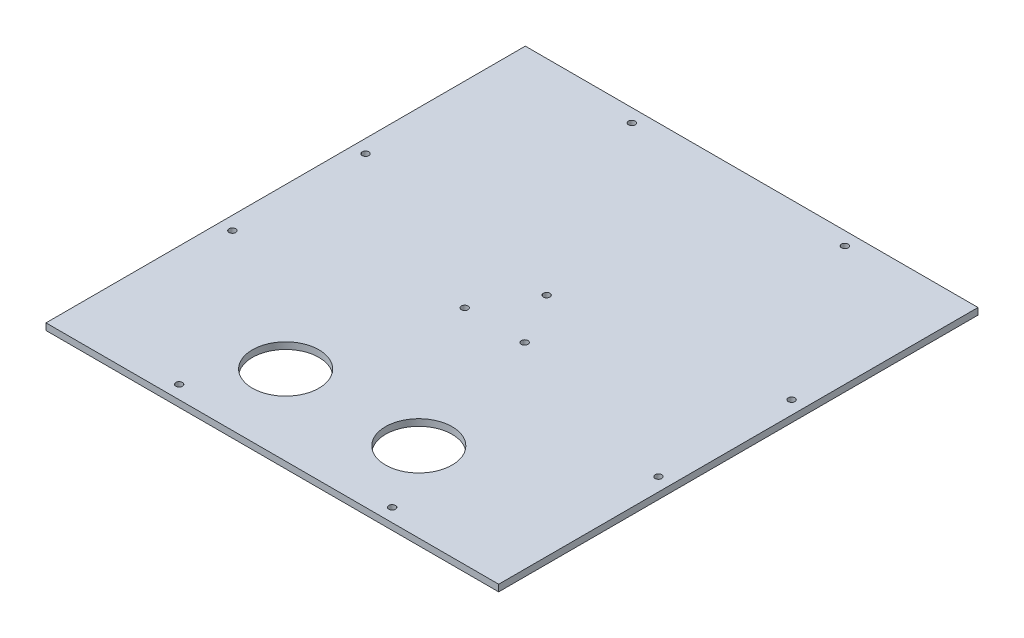
from build123d import *

# Parameters (mm, degrees)
SKETCH1_W           = 215.9
SKETCH1_H           = 228.6
BOSS_EXTRUDE1_DEPTH = 3.175
SKETCH2_R           = 15.875
CUT_EXTRUDE1_DEPTH  = 315.453256661
SKETCH3_R           = 1.5875
CUT_EXTRUDE2_DEPTH  = 315.453256661
SKETCH4_R           = 1.5875
CUT_EXTRUDE3_DEPTH  = 315.453256661


with BuildPart() as part:
    # Sketch1 → Boss-Extrude1 (new body)
    with BuildSketch(Plane(origin=(0, 0, 0), x_dir=(1, 0, 0), z_dir=(0, 1, 0))):
        with Locations((107.95, 114.3)):
            Rectangle(SKETCH1_W, SKETCH1_H)
    extrude(amount=BOSS_EXTRUDE1_DEPTH)

    # Sketch2 → Cut-Extrude1 (cut, through all)
    with BuildSketch(Plane(origin=(0, 3.175, 0), x_dir=(1, 0, 0), z_dir=(0, 1, 0))):
        with Locations((139.7, 38.1)):
            Circle(SKETCH2_R)
        with Locations((76.2, 38.1)):
            Circle(SKETCH2_R)
    extrude(amount=-CUT_EXTRUDE1_DEPTH, mode=Mode.SUBTRACT)

    # Sketch3 → Cut-Extrude2 (cut, through all)
    with BuildSketch(Plane(origin=(0, 3.175, 0), x_dir=(1, 0, 0), z_dir=(0, 1, 0))):
        with Locations((107.95, 130.81)):
            Circle(SKETCH3_R)
        with Locations((122.248079416, 106.045)):
            Circle(SKETCH3_R)
        with Locations((93.651920584, 106.045)):
            Circle(SKETCH3_R)
    extrude(amount=-CUT_EXTRUDE2_DEPTH, mode=Mode.SUBTRACT)

    # Sketch4 → Cut-Extrude3 (cut, through all)
    with BuildSketch(Plane(origin=(0, 3.175, 0), x_dir=(1, 0, 0), z_dir=(0, 1, 0))):
        with Locations((6.35, 146.05)):
            Circle(SKETCH4_R)
        with Locations((6.35, 82.55)):
            Circle(SKETCH4_R)
        with Locations((57.15, 6.35)):
            Circle(SKETCH4_R)
        with Locations((57.15, 222.25)):
            Circle(SKETCH4_R)
        with Locations((158.75, 6.35)):
            Circle(SKETCH4_R)
        with Locations((209.55, 82.55)):
            Circle(SKETCH4_R)
        with Locations((209.55, 146.05)):
            Circle(SKETCH4_R)
        with Locations((158.75, 222.25)):
            Circle(SKETCH4_R)
    extrude(amount=-CUT_EXTRUDE3_DEPTH, mode=Mode.SUBTRACT)


solid = part.part
